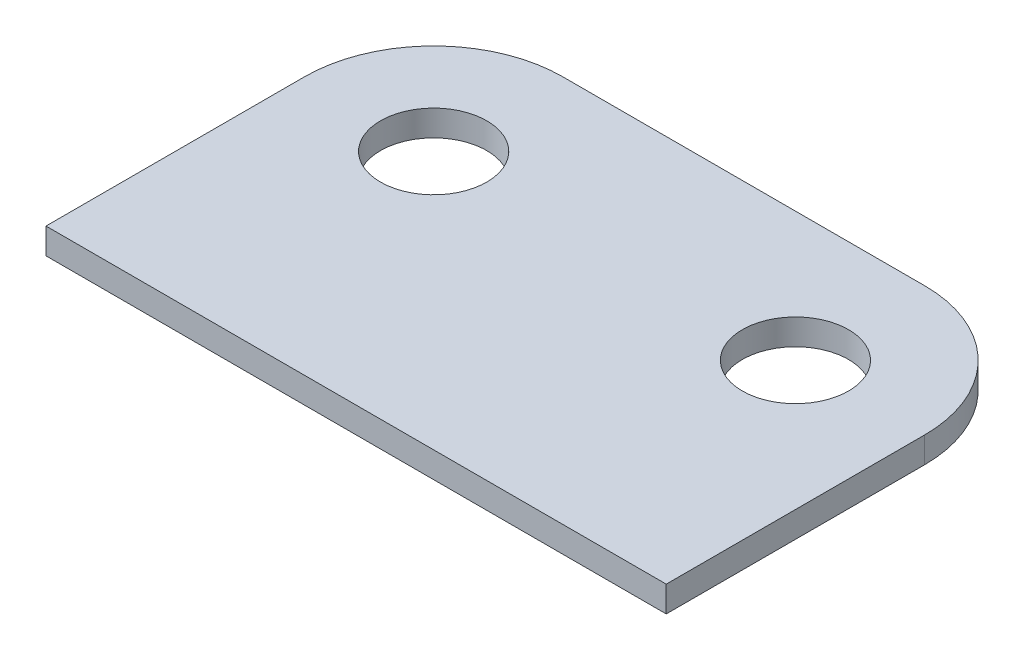
from build123d import *

# Parameters (mm, degrees)
SKETCH1_R           = 3.2639
BOSS_EXTRUDE1_DEPTH = 1.5875


with BuildPart() as part:
    # Sketch1 → Boss-Extrude1 (new body)
    with BuildSketch(Plane(origin=(0, 0, 0), x_dir=(1, 0, 0), z_dir=(0, 1, 0))):
        with BuildLine():
            Line((-19.05, 0), (19.05, 0))
            Line((19.05, 0), (19.05, 15.875))
            ThreePointArc((19.05, 15.875), (16.725160076, 21.487660076), (11.1125, 23.8125))
            Line((11.1125, 23.8125), (-11.1125, 23.8125))
            ThreePointArc((-11.1125, 23.8125), (-16.725160076, 21.487660076), (-19.05, 15.875))
            Line((-19.05, 15.875), (-19.05, 0))
        make_face()
        with Locations((-11.1125, 15.875)):
            Circle(SKETCH1_R, mode=Mode.SUBTRACT)
        with Locations((11.1125, 15.875)):
            Circle(SKETCH1_R, mode=Mode.SUBTRACT)
    extrude(amount=BOSS_EXTRUDE1_DEPTH)


solid = part.part
